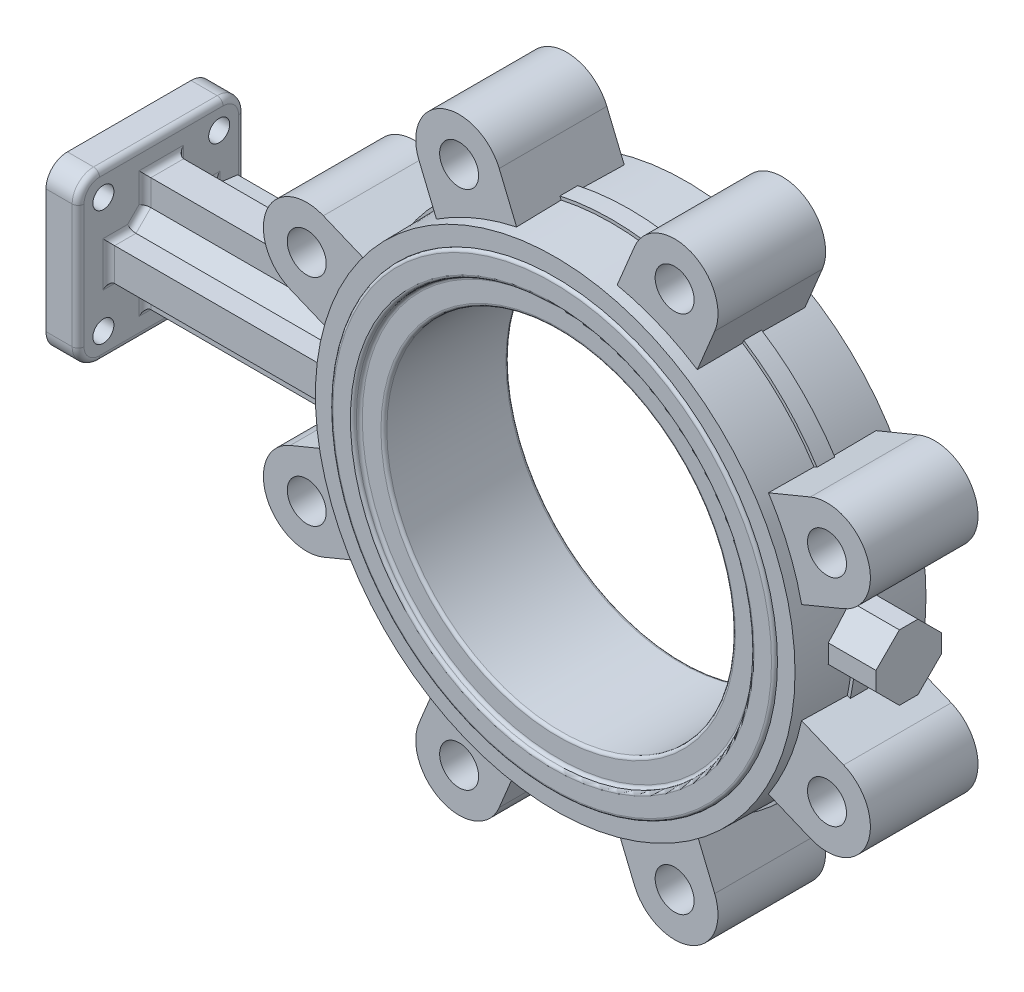
from build123d import *

# Parameters (mm, degrees)
SKETCH1_R                     = 103.000048
BOSS_EXTRUDE1_DEPTH           = 27.9908
BOSS_EXTRUDE1_TAPER           = 1
BOSS_EXTRUDE1_OTHER_WAY_DEPTH = 27.9908
BOSS_EXTRUDE1_OTHER_WAY_TAPER = 1
SKETCH2_R                     = 95
BOSS_EXTRUDE2_DEPTH           = 1.27
BOSS_EXTRUDE3_START           = 1.27
SKETCH3_R                     = 95
BOSS_EXTRUDE3_DEPTH           = 1.27
SKETCH5_R                     = 85
CUT_EXTRUDE2_DEPTH            = 2.54
CUT_EXTRUDE1_START            = -2.54
SKETCH4_R                     = 85
CUT_EXTRUDE1_DEPTH            = 2.54
CUT_EXTRUDE3_DEPTH            = 157.051143398
CUT_EXTRUDE3_DEPTH_BACK       = 157.051143398
SKETCH6_R                     = 74.5
SKETCH7_W                     = 6.35
SKETCH7_H                     = 7.62
BOSS_EXTRUDE4_DEPTH           = 18.796
BOSS_EXTRUDE4_DEPTH_BACK      = 10
SKETCH8_W                     = 27.94
SKETCH8_H                     = 27.94
CHAMFER1_SIZE                 = 10
BOSS_EXTRUDE5_DEPTH           = 92.0663894
BOSS_EXTRUDE5_DEPTH_BACK      = 12.7
SKETCH11_W                    = 71.12
SKETCH11_H                    = 71.12
BOSS_EXTRUDE7_DEPTH           = 13.716
CHAMFER2_SIZE                 = 6.35
FILLET1_R                     = 9.144
SKETCH12_W                    = 57.15
SKETCH12_H                    = 31.75
BOSS_EXTRUDE8_DEPTH           = 18.669
BOSS_EXTRUDE8_TAPER           = 4
FILLET2_R                     = 1.27
SKETCH14_R                    = 11.5062
CUT_EXTRUDE5_DEPTH            = 7.62
M8_CLEARANCE_HOLE1_D          = 9
M8_CLEARANCE_HOLE1_DEPTH      = 13.716
BOSS_EXTRUDE13_DEPTH          = 23
CIRPATTERN1_COUNT             = 8
F_3_4_10_TAPPED_HOLE1_D       = 16.66748
FILLET3_R                     = 2.54


with BuildPart() as part:
    # Sketch1 → Boss-Extrude1 (new body)
    with BuildSketch(Plane.XY):
        Circle(SKETCH1_R)
    extrude(amount=BOSS_EXTRUDE1_DEPTH, taper=BOSS_EXTRUDE1_TAPER)

    # Sketch1 → Boss-Extrude1 other way (add)
    with BuildSketch(Plane.XY):
        Circle(SKETCH1_R)
    extrude(amount=-BOSS_EXTRUDE1_OTHER_WAY_DEPTH, taper=BOSS_EXTRUDE1_OTHER_WAY_TAPER)

    # Sketch2 → Boss-Extrude2 (add)
    with BuildSketch(Plane.XY.offset(27.9908)):
        Circle(SKETCH2_R)
    extrude(amount=BOSS_EXTRUDE2_DEPTH)

    # Sketch3 → Boss-Extrude3 (add)
    with BuildSketch(Plane(origin=(0, 0, -27.9908), x_dir=(-1, 0, 0), z_dir=(0, 0, -1)).offset(BOSS_EXTRUDE3_START)):
        with Locations(Location((0, 0, 0), (0, 0, 180))):
            Circle(SKETCH3_R)
    extrude(amount=-BOSS_EXTRUDE3_DEPTH)

    # Sketch5 → Cut-Extrude2 (cut)
    with BuildSketch(Plane.XY.offset(29.2608)):
        Circle(SKETCH5_R)
    extrude(amount=-CUT_EXTRUDE2_DEPTH, mode=Mode.SUBTRACT)

    # Sketch4 → Cut-Extrude1 (cut)
    with BuildSketch(Plane(origin=(0, 0, -29.2608), x_dir=(-1, 0, 0), z_dir=(0, 0, -1)).offset(CUT_EXTRUDE1_START)):
        with Locations(Location((0, 0, 0), (0, 0, 180))):
            Circle(SKETCH4_R)
    extrude(amount=CUT_EXTRUDE1_DEPTH, mode=Mode.SUBTRACT)

    # Sketch6 → Cut-Extrude3 (cut, two sides: drawn at the far end of the back side and taken through both)
    with BuildSketch(Plane.XY.offset(26.7208).offset(-CUT_EXTRUDE3_DEPTH_BACK)):
        Circle(SKETCH6_R)
    extrude(amount=CUT_EXTRUDE3_DEPTH + CUT_EXTRUDE3_DEPTH_BACK, mode=Mode.SUBTRACT)

    # Sketch7 → Revolve1 (revolve)
    with BuildSketch(Plane(origin=(0, 0, 0), x_dir=(1, 0, 0), z_dir=(0, 1, 0)), mode=Mode.PRIVATE) as revolve1_sk:
        with Locations((-101.114466769, 0)):
            Rectangle(SKETCH7_W, SKETCH7_H)
    revolve(revolve1_sk.sketch.rotate(Axis((0, 0, 0), (0, 0, -1)), 180), axis=Axis((0, 0, 0), (0, 0, -1)))

    # Sketch8 → Boss-Extrude4 (add, two sides: drawn at the far end of the back side and taken through both)
    with BuildSketch(Plane(origin=(104.289466769, 0, 0), x_dir=(0, 0, -1), z_dir=(1, 0, 0)).offset(-BOSS_EXTRUDE4_DEPTH_BACK)):
        Rectangle(SKETCH8_W, SKETCH8_H)
    extrude(amount=BOSS_EXTRUDE4_DEPTH + BOSS_EXTRUDE4_DEPTH_BACK)

    # Chamfer1
    chamfer1_edges = [part.edges().sort_by_distance(p)[0] for p in [
        (112.443803833, 13.97, -13.97),
        (112.443803833, -13.97, -13.97),
        (112.443803833, -13.97, 13.97),
        (112.443803833, 13.97, 13.97),
    ]]
    chamfer(chamfer1_edges, length=CHAMFER1_SIZE)

    # Sketch9 → Boss-Extrude5 (add, two sides: drawn at the far end of the back side and taken through both)
    with BuildSketch(Plane.ZY.offset(104.289466769).offset(-BOSS_EXTRUDE5_DEPTH_BACK)):
        Polygon((-22.479, 7), (-7, 7), (-7, 24.4094), (7, 24.4094), (7, 7), (22.479, 7), (22.479, -7), (7, -7), (7, -24.4094), (-7, -24.4094), (-7, -7), (-22.479, -7), align=None)
    extrude(amount=BOSS_EXTRUDE5_DEPTH + BOSS_EXTRUDE5_DEPTH_BACK)

    # Sketch11 → Boss-Extrude7 (add)
    with BuildSketch(Plane.ZY.offset(196.355856169)):
        Rectangle(SKETCH11_W, SKETCH11_H)
    extrude(amount=BOSS_EXTRUDE7_DEPTH)

    # Chamfer2
    chamfer2_edges = [part.edges().sort_by_distance(p)[0] for p in [
        (-149.497647983, 7, 7),
        (-149.497647983, -7, 7),
        (-149.497647983, -7, -7),
        (-149.497647983, 7, -7),
    ]]
    chamfer(chamfer2_edges, length=CHAMFER2_SIZE)

    # Fillet1
    fillet1_edges = [part.edges().sort_by_distance(p)[0] for p in [
        (-203.213856169, 35.56, -35.56),
        (-203.213856169, -35.56, -35.56),
        (-203.213856169, -35.56, 35.56),
        (-203.213856169, 35.56, 35.56),
    ]]
    fillet(fillet1_edges, radius=FILLET1_R)

    # Sketch12 → Boss-Extrude8 (add)
    with BuildSketch(Plane(origin=(0, 0, -3.81), x_dir=(-1, 0, 0), z_dir=(0, 0, -1))):
        with Locations((158.890856169, 0)):
            Rectangle(SKETCH12_W, SKETCH12_H)
    extrude(amount=BOSS_EXTRUDE8_DEPTH, taper=BOSS_EXTRUDE8_TAPER)

    # Fillet2
    fillet2_edges = [part.edges().sort_by_distance(p)[0] for p in [
        (-95, 0, 29.2608),
        (-95, 0, -29.2608),
        (-85, 0, 26.7208),
        (-85, 0, 29.2608),
        (-85, 0, -26.7208),
        (-85, 0, -29.2608),
        (-74.5, 0, 26.7208),
        (-74.5, 0, -26.7208),
    ]]
    fillet(fillet2_edges, radius=FILLET2_R - 0.0001)  # a hair under: the kernel refuses the full size

    # Sketch14 → Cut-Extrude5 (cut)
    with BuildSketch(Plane.ZY.offset(210.071856169)):
        Circle(SKETCH14_R)
    extrude(amount=-CUT_EXTRUDE5_DEPTH, mode=Mode.SUBTRACT)

    # M8 Clearance Hole1
    with Locations(Plane.ZY.offset(210.071856169)):
        with Locations((-24.748737342, 24.748737342), (24.748737342, 24.748737342), (24.748737342, -24.748737342), (-24.748737342, -24.748737342)):
            Hole(M8_CLEARANCE_HOLE1_D / 2, depth=M8_CLEARANCE_HOLE1_DEPTH)

    # Sketch22 → Boss-Extrude13 (add, symmetric)
    with BuildSketch(Plane.XY):
        with BuildLine():
            Line((-104.088750913, 63.184688496), (-86.050380247, 55.712950724))
            ThreePointArc((-86.050380247, 55.712950724), (-94.708245995, 39.22943996), (-100.241812653, 21.45180214))
            Line((-100.241812653, 21.45180214), (-118.280183319, 28.923539913))
            ThreePointArc((-118.280183319, 28.923539913), (-128.315041408, 53.149830408), (-104.088750913, 63.184688496))
        make_face()
    boss_extrude13 = extrude(amount=BOSS_EXTRUDE13_DEPTH, both=True)

    # CirPattern1: Boss-Extrude13 ×8 about axis
    cirpattern1_axis = Axis((0, 0, 0), (0, 0, 1))
    for i in range(1, CIRPATTERN1_COUNT):
        add(boss_extrude13.rotate(cirpattern1_axis, i * 360 / CIRPATTERN1_COUNT))

    # 3/4-10 Tapped Hole1 (through all)
    with Locations(Plane.XY.offset(23)):
        with Locations((-46.054114205, 111.184467116), (-111.184467116, 46.054114205), (111.184467116, 46.054114205), (46.054114205, 111.184467116), (111.184467116, -46.054114205), (46.054114205, -111.184467116), (-46.054114205, -111.184467116), (-111.184467116, -46.054114205)):
            Hole(F_3_4_10_TAPPED_HOLE1_D / 2)

    # Fillet3
    fillet3_edges = [part.edges().sort_by_distance(p)[0] for p in [
        (-196.355856169, 0, 22.479),
        (-196.355856169, 7, 17.9145),
        (-196.355856169, 24.4094, 0),
        (-196.355856169, 18.8797, -7),
        (-196.355856169, 0, -22.479),
        (-196.355856169, -7, -17.9145),
        (-196.355856169, -24.4094, 0),
        (-196.355856169, -18.8797, 7),
        (-196.355856169, -7, 17.9145),
        (-196.355856169, 18.8797, 7),
        (-196.355856169, 7, -17.9145),
        (-196.355856169, -18.8797, -7),
        (-196.355856169, 10.175, -10.175),
        (-196.355856169, -10.175, -10.175),
        (-196.355856169, -10.175, 10.175),
        (-196.355856169, 10.175, 10.175),
        (-196.355856169, 0, -35.56),
        (-196.355856169, 35.56, 0),
        (-196.355856169, 0, 35.56),
        (-196.355856169, -35.56, 0),
        (-196.355856169, -32.881784407, 32.881784407),
        (-196.355856169, -32.881784407, -32.881784407),
        (-196.355856169, 32.881784407, 32.881784407),
        (-196.355856169, 32.881784407, -32.881784407),
    ]]
    fillet(fillet3_edges, radius=FILLET3_R)


solid = part.part
